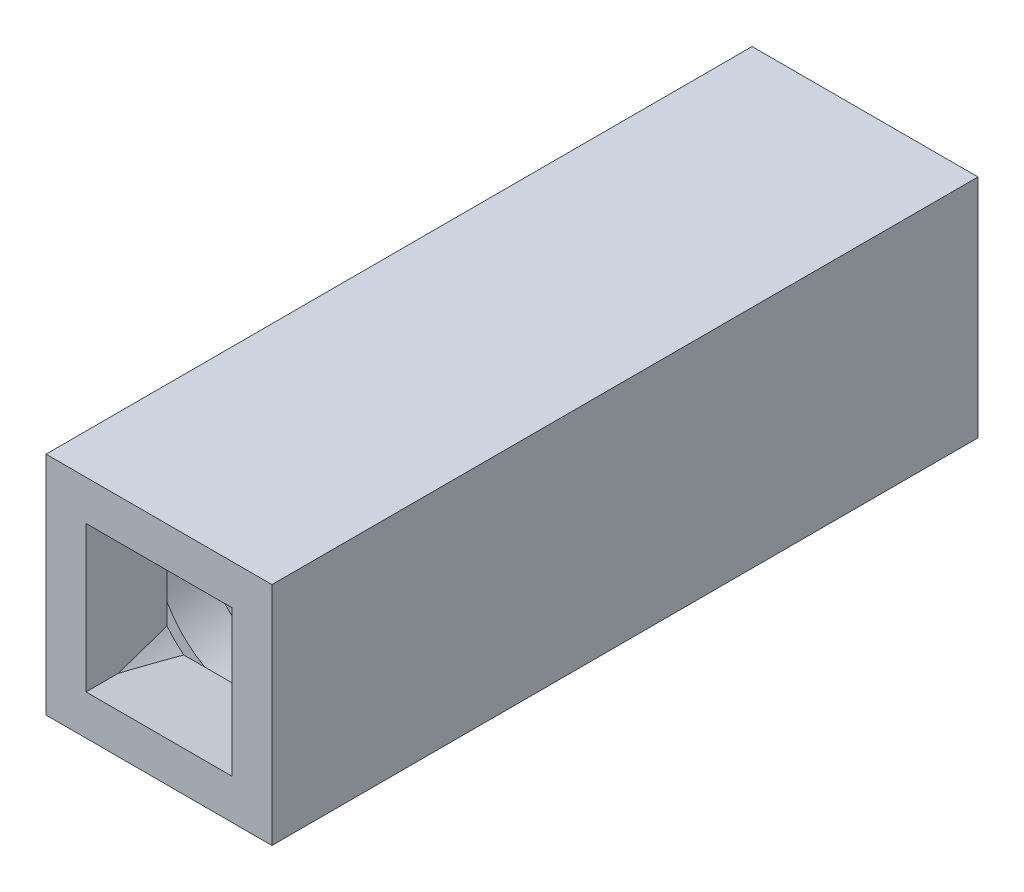
from build123d import *
from build123d.topology import SkipClean

# Parameters (mm, degrees)
SKETCH1_R           = 29.845
SKETCH1_R_2         = 26.67
BOSS_EXTRUDE1_DEPTH = 165.1
SKETCH2_W           = 59.69
SKETCH2_H           = 38.1
CUT_EXTRUDE1_DEPTH  = 171.409677102
BOSS_EXTRUDE2_DEPTH = 6.35
SKETCH5_R           = 29.845
SKETCH5_R_2         = 6.985
BOSS_EXTRUDE4_DEPTH = 6.35
BOSS_EXTRUDE5_START = -6.35
SKETCH4_R           = 29.845
SKETCH4_R_2         = 6.985
BOSS_EXTRUDE5_DEPTH = 6.35
SKETCH6_W           = 60.96
SKETCH6_H           = 60.96
SKETCH6_R           = 29.845
BOSS_EXTRUDE7_DEPTH = 190.5
SKETCH7_W           = 60.96
SKETCH7_H           = 60.96
SKETCH7_W_2         = 39.37
SKETCH7_H_2         = 39.37
BOSS_EXTRUDE8_DEPTH = 25.4
BOSS_EXTRUDE8_DRAFT = -8


with BuildPart() as part:
    # Sketch1 → Boss-Extrude1 (new body)
    with BuildSketch(Plane.XY):
        Circle(SKETCH1_R)
        Circle(SKETCH1_R_2, mode=Mode.SUBTRACT)
    extrude(amount=BOSS_EXTRUDE1_DEPTH)

    # Sketch2 → Cut-Extrude1 (cut, through all)
    with BuildSketch(Plane(origin=(0, 0, 0), x_dir=(1, 0, 0), z_dir=(0, 1, 0))):
        with Locations((0, -18.194460122)):
            Rectangle(SKETCH2_W, SKETCH2_H)
    extrude(amount=-CUT_EXTRUDE1_DEPTH, mode=Mode.SUBTRACT)

    # Sketch3 → Boss-Extrude2 (add)
    with BuildSketch(Plane(origin=(0, 0, 0), x_dir=(-1, 0, 0), z_dir=(0, 0, -1))):
        with BuildLine():
            Line((-29.845, 0), (-6.985, 0))
            ThreePointArc((-6.985, 0), (0, 6.985), (6.985, 0))
            Line((6.985, 0), (29.845, 0))
            ThreePointArc((29.845, 0), (0, 29.845), (-29.845, 0))
        make_face()
    extrude(amount=-BOSS_EXTRUDE2_DEPTH)

    # Sketch5 → Boss-Extrude4 (add)
    with SkipClean():  # the faces are left unmerged after this step: merging them gives an invalid solid
        with BuildSketch(Plane(origin=(0, 0, 0), x_dir=(-1, 0, 0), z_dir=(0, 0, -1))):
            Circle(SKETCH5_R)
            Circle(SKETCH5_R_2, mode=Mode.SUBTRACT)
        extrude(amount=-BOSS_EXTRUDE4_DEPTH)

    # Sketch4 → Boss-Extrude5 (add)
    with SkipClean():  # the faces are left unmerged after this step: merging them gives an invalid solid
        with BuildSketch(Plane.XY.offset(165.1).offset(BOSS_EXTRUDE5_START)):
            Circle(SKETCH4_R)
            with BuildLine():
                Line((1.27, 9.45004085), (1.27, 26.639744744))
                ThreePointArc((1.27, 26.639744744), (18.858537854, 18.858537854), (26.639744744, 1.27))
                Line((26.639744744, 1.27), (9.517329266, 1.27))
                ThreePointArc((9.517329266, 1.27), (6.784923303, 6.762723487), (1.27, 9.45004085))
            make_face(mode=Mode.SUBTRACT)
            with BuildLine():
                Line((9.488978712, -1.465384615), (26.639744744, -1.27))
                ThreePointArc((26.639744744, -1.27), (18.858537854, -18.858537854), (1.27, -26.639744744))
                Line((1.27, -26.639744744), (1.453480675, -9.425070814))
                ThreePointArc((1.453480675, -9.425070814), (6.780569847, -6.767038646), (9.488978712, -1.465384615))
            make_face(mode=Mode.SUBTRACT)
            with BuildLine():
                Line((-1.477288556, -9.397267918), (-1.27, -26.639744744))
                ThreePointArc((-1.27, -26.639744744), (-18.858537854, -18.858537854), (-26.639744744, -1.27))
                Line((-26.639744744, -1.27), (-9.33422749, -1.465384615))
                ThreePointArc((-9.33422749, -1.465384615), (-6.689709997, -6.703146826), (-1.477288556, -9.397267918))
            make_face(mode=Mode.SUBTRACT)
            with BuildLine():
                Line((-9.33422749, 1.465384615), (-26.639744744, 1.27))
                ThreePointArc((-26.639744744, 1.27), (-18.858537854, 18.858537854), (-1.27, 26.639744744))
                Line((-1.27, 26.639744744), (-1.477288556, 9.397267918))
                ThreePointArc((-1.477288556, 9.397267918), (-6.689709997, 6.703146826), (-9.33422749, 1.465384615))
            make_face(mode=Mode.SUBTRACT)
            Circle(SKETCH4_R_2, mode=Mode.SUBTRACT)
        extrude(amount=BOSS_EXTRUDE5_DEPTH)

    # Sketch6 → Boss-Extrude7 (add)
    with SkipClean():  # the faces are left unmerged after this step: merging them gives an invalid solid
        with BuildSketch(Plane.XY):
            Rectangle(SKETCH6_W, SKETCH6_H)
            Circle(SKETCH6_R, mode=Mode.SUBTRACT)
        extrude(amount=BOSS_EXTRUDE7_DEPTH)


with BuildPart() as boss_extrude8_tool:
    # Sketch7 → Boss-Extrude8 (with draft: the straight prism first)
    with BuildSketch(Plane.XY.offset(190.5)):
        Rectangle(SKETCH7_W, SKETCH7_H)
        Rectangle(SKETCH7_W_2, SKETCH7_H_2, mode=Mode.SUBTRACT)
    extrude(amount=-BOSS_EXTRUDE8_DEPTH)
    # Boss-Extrude8: the draft: its side faces are tilted about the plane it starts from
    boss_extrude8_sides = [boss_extrude8_tool.faces().sort_by_distance(p)[0] for p in [
        (0, 30.48, 177.8),
        (-30.48, 0, 177.8),
        (0, -30.48, 177.8),
        (30.48, 0, 177.8),
        (-19.685, 0, 177.8),
        (0, 19.685, 177.8),
        (19.685, 0, 177.8),
        (0, -19.685, 177.8),
    ]]
    draft(boss_extrude8_sides, Plane.XY.offset(190.5), BOSS_EXTRUDE8_DRAFT)


with BuildPart() as part_1:
    add(part.part)

    # Boss-Extrude8: add boss_extrude8_tool
    add(boss_extrude8_tool.part)


solid = part_1.part
